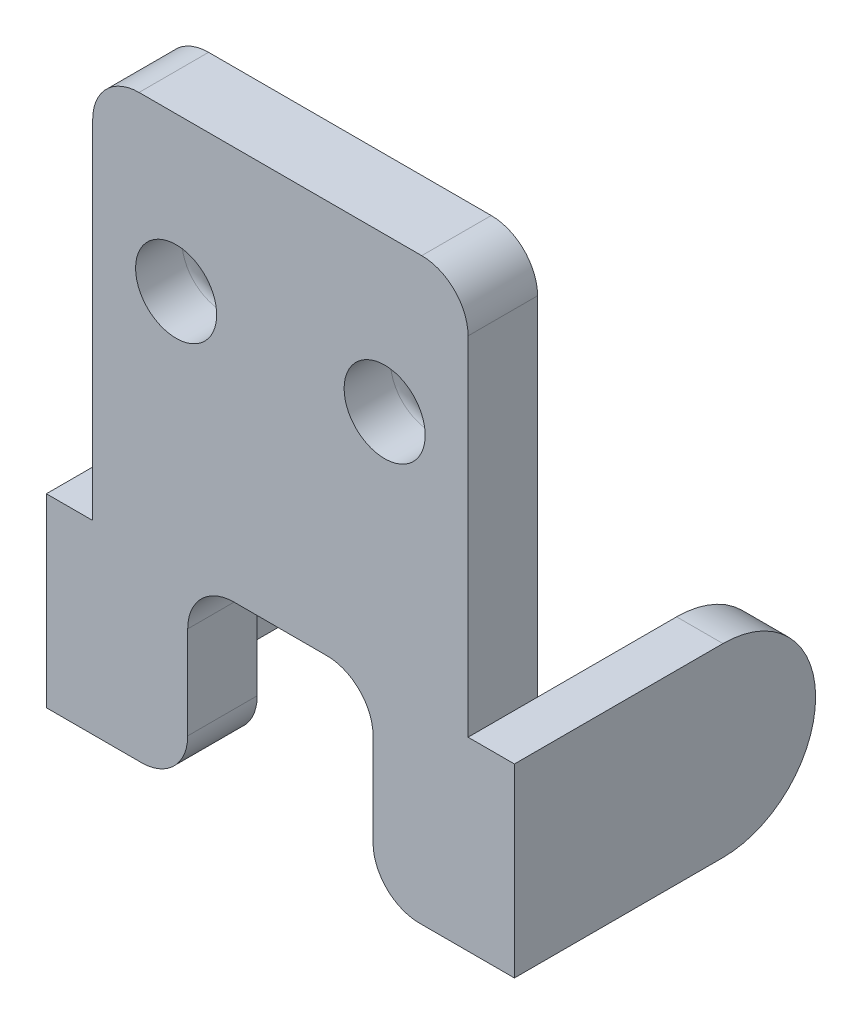
from build123d import *

# Parameters (mm, degrees)
ESQUISSE1_W             = 16.2
ESQUISSE1_H             = 25
BOSS_EXTRU_1_DEPTH      = 3
ESQUISSE2_W             = 13
ESQUISSE2_H             = 8
BOSS_EXTRU_2_DEPTH      = 2
ESQUISSE3_R             = 1.8
BOSS_EXTRU_3_DEPTH      = 1.5
ESQUISSE5_W             = 13
ESQUISSE5_H             = 8
BOSS_EXTRU_4_DEPTH      = 2
ESQUISSE6_R             = 1.8
BOSS_EXTRU_5_DEPTH      = 1.5
ENL_V_MAT_EXTRU_1_REACH = 34.5
ESQUISSE7_W             = 8
ESQUISSE7_H             = 8
ENL_V_MAT_EXTRU_2_REACH = 34.5
ESQUISSE8_R             = 1.75
CONG_1_R                = 1
CONG_2_R                = 4
CONG_3_R                = 2
CONG_4_R                = 2


with BuildPart() as part:
    # Esquisse1 → Boss.-Extru.1 (new body)
    with BuildSketch(Plane.XY):
        with Locations((8.1, 12.5)):
            Rectangle(ESQUISSE1_W, ESQUISSE1_H)
    extrude(amount=BOSS_EXTRU_1_DEPTH)

    # Esquisse2 → Boss.-Extru.2 (add)
    with BuildSketch(Plane.ZY):
        with Locations((-3.5, 4)):
            Rectangle(ESQUISSE2_W, ESQUISSE2_H)
    extrude(amount=BOSS_EXTRU_2_DEPTH)

    # Esquisse3 → Boss.-Extru.3 (add)
    with BuildSketch(Plane(origin=(0, 0, 0), x_dir=(0, 0, -1), z_dir=(1, 0, 0))):
        with Locations(Location((7, 4.035774971, 0), (0, 0, 180))):
            Circle(ESQUISSE3_R)
    extrude(amount=BOSS_EXTRU_3_DEPTH)

    # Esquisse5 → Boss.-Extru.4 (add)
    with BuildSketch(Plane(origin=(16.2, 0, 0), x_dir=(0, 0, -1), z_dir=(1, 0, 0))):
        with Locations((3.5, 4)):
            Rectangle(ESQUISSE5_W, ESQUISSE5_H)
    extrude(amount=BOSS_EXTRU_4_DEPTH)

    # Esquisse6 → Boss.-Extru.5 (add)
    with BuildSketch(Plane.ZY.offset(-16.2)):
        with Locations((-7, 3.879731229)):
            Circle(ESQUISSE6_R)
    extrude(amount=BOSS_EXTRU_5_DEPTH)

    # Esquisse7 → Enlèv. mat.-Extru.1 (cut, up to next)
    with BuildSketch(Plane(origin=(0, 0, 0), x_dir=(-1, 0, 0), z_dir=(0, 0, -1)), mode=Mode.PRIVATE) as enl_v_mat_extru_1_sk1:
        with Locations((-8.1, 4)):
            Rectangle(ESQUISSE7_W, ESQUISSE7_H)
    enl_v_mat_extru_1_tool1 = extrude(enl_v_mat_extru_1_sk1.sketch, amount=-ENL_V_MAT_EXTRU_1_REACH, mode=Mode.PRIVATE) & part.part
    add(enl_v_mat_extru_1_tool1.solids().sort_by_distance((8.1, 4, 0))[0], mode=Mode.SUBTRACT)

    # Esquisse8 → Enlèv. mat.-Extru.2 (cut, up to next)
    with BuildSketch(Plane(origin=(0, 0, 0), x_dir=(-1, 0, 0), z_dir=(0, 0, -1)), mode=Mode.PRIVATE) as enl_v_mat_extru_2_sk1:
        with Locations((-12.6, 18.360124913)):
            Circle(ESQUISSE8_R)
    enl_v_mat_extru_2_tool1 = extrude(enl_v_mat_extru_2_sk1.sketch, amount=-ENL_V_MAT_EXTRU_2_REACH, mode=Mode.PRIVATE) & part.part
    # Esquisse8 → Enlèv. mat.-Extru.2 (cut, up to next)
    with BuildSketch(Plane(origin=(0, 0, 0), x_dir=(-1, 0, 0), z_dir=(0, 0, -1)), mode=Mode.PRIVATE) as enl_v_mat_extru_2_sk2:
        with Locations((-3.6, 18.360124913)):
            Circle(ESQUISSE8_R)
    enl_v_mat_extru_2_tool2 = extrude(enl_v_mat_extru_2_sk2.sketch, amount=-ENL_V_MAT_EXTRU_2_REACH, mode=Mode.PRIVATE) & part.part
    add(enl_v_mat_extru_2_tool1.solids().sort_by_distance((12.6, 18.360125, 0))[0], mode=Mode.SUBTRACT)
    add(enl_v_mat_extru_2_tool2.solids().sort_by_distance((3.6, 18.360125, 0))[0], mode=Mode.SUBTRACT)

    # Congé1
    cong_1_edges = [part.edges().sort_by_distance(p)[0] for p in [
        (14.35, 18.360124913, 0),
        (5.35, 18.360124913, 0),
    ]]
    fillet(cong_1_edges, radius=CONG_1_R)

    # Congé2
    cong_2_edges = [part.edges().sort_by_distance(p)[0] for p in [
        (-1, 8, -10),
        (-1, 0, -10),
        (17.2, 0, -10),
        (17.2, 8, -10),
    ]]
    fillet(cong_2_edges, radius=CONG_2_R - 0.0001)  # a hair under: the kernel refuses the full size

    # Congé3
    cong_3_edges = [part.edges().sort_by_distance(p)[0] for p in [
        (12.1, 0, 1.5),
        (12.1, 8, 1.5),
        (4.1, 8, 1.5),
        (4.1, 0, 1.5),
    ]]
    fillet(cong_3_edges, radius=CONG_3_R)

    # Congé4
    cong_4_edges = [part.edges().sort_by_distance(p)[0] for p in [
        (0, 25, 1.5),
        (16.2, 25, 1.5),
    ]]
    fillet(cong_4_edges, radius=CONG_4_R)


solid = part.part
